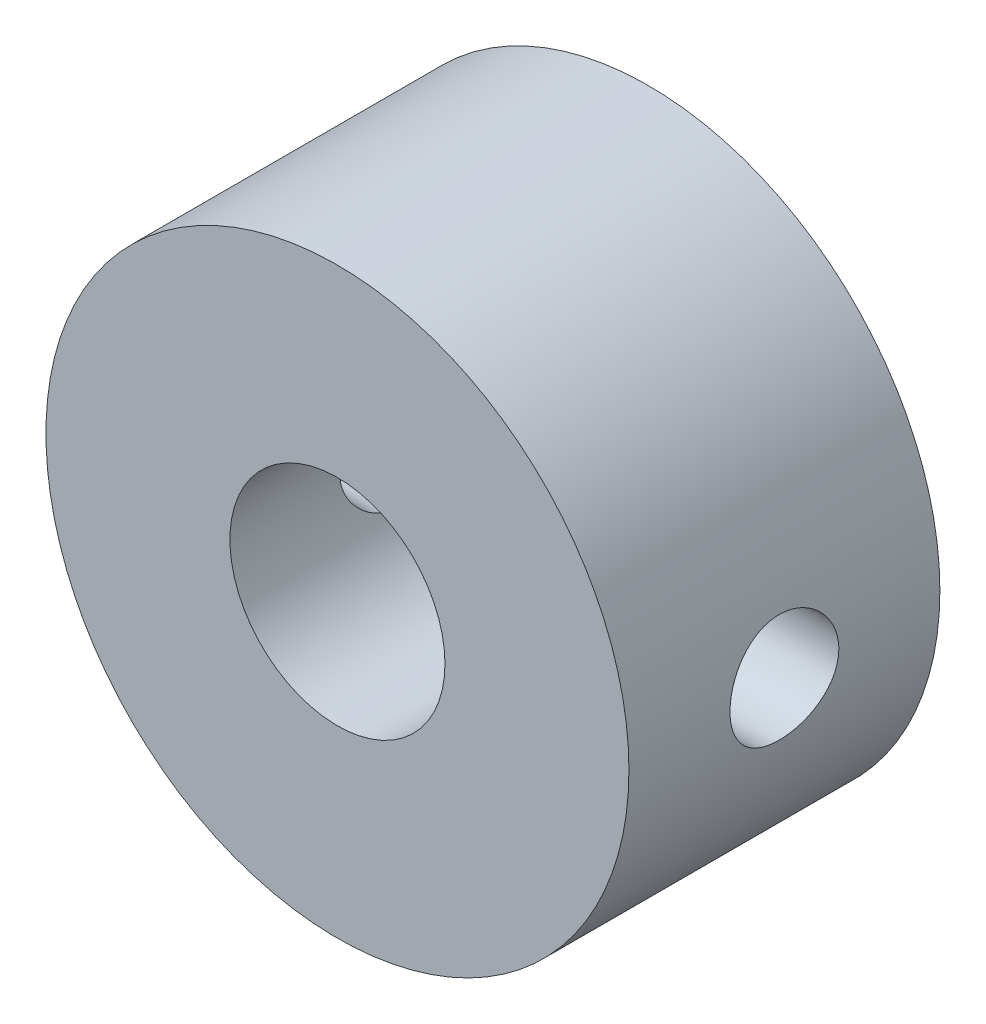
from build123d import *

# Parameters (mm, degrees)
SKETCH1_R           = 11.25
BOSS_EXTRUDE1_DEPTH = 12
SKETCH2_R           = 4.15
CUT_EXTRUDE1_DEPTH  = 15
SKETCH3_R           = 2.1
CUT_EXTRUDE2_DEPTH  = 5
SKETCH4_R           = 1.75
CUT_EXTRUDE3_DEPTH  = 25.016921288


with BuildPart() as part:
    # Sketch1 → Boss-Extrude1 (new body)
    with BuildSketch(Plane.XY):
        Circle(SKETCH1_R)
    extrude(amount=BOSS_EXTRUDE1_DEPTH)

    # Sketch2 → Cut-Extrude1 (cut)
    with BuildSketch(Plane.XY.offset(12)):
        Circle(SKETCH2_R)
    extrude(amount=-CUT_EXTRUDE1_DEPTH, mode=Mode.SUBTRACT)

    # Sketch3 → Cut-Extrude2 (cut)
    with BuildSketch(Plane(origin=(-11.25, 0, 0), x_dir=(0, 0, -1), z_dir=(1, 0, 0))):
        with Locations((-6, 0)):
            Circle(SKETCH3_R)
    cut_extrude2 = extrude(amount=CUT_EXTRUDE2_DEPTH, mode=Mode.SUBTRACT)

    # Sketch4 → Cut-Extrude3 (cut, through all)
    with BuildSketch(Plane.ZY.offset(6.25)):
        with Locations((6, 0)):
            Circle(SKETCH4_R)
    extrude(amount=-CUT_EXTRUDE3_DEPTH, mode=Mode.SUBTRACT)

    # Mirror1: Cut-Extrude2 across plane
    add(cut_extrude2.mirror(Plane(origin=(0, 0, 0), x_dir=(0, 0, 1), z_dir=(1, 0, 0))), mode=Mode.SUBTRACT)


solid = part.part
